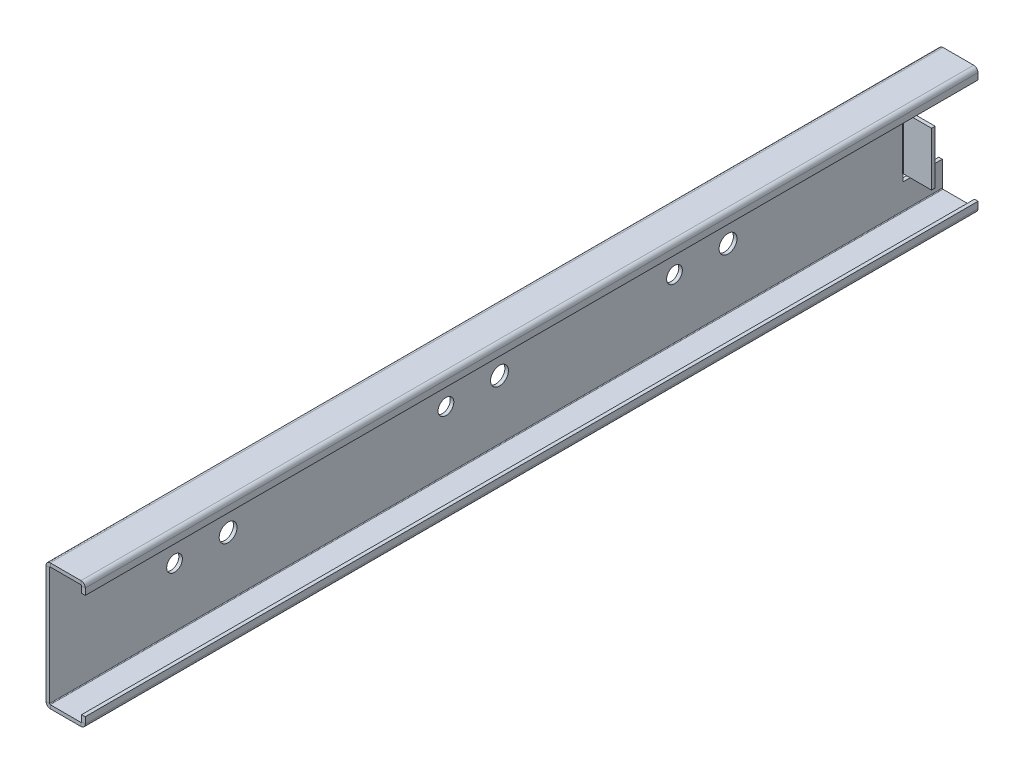
from build123d import *

# Parameters (mm, degrees)
SM_BASE_FLANGE_1_DEPTH           = 125
SKETCH_3_W                       = 11
SKETCH_3_H                       = 19
CUT_EXTRUDE_1_DEPTH              = 1
SM_EDGE_FLANGE_1_STRIP_W         = 4.4
SM_EDGE_FLANGE_1_STRIP_H         = 1
SM_EDGE_FLANGE_1_STRIP_CUT_DEPTH = 15
SM_EDGE_FLANGE_1_DEPTH           = 15
SKETCH_7_R                       = 2.5
SKETCH_7_R_2                     = 2.2
CUT_EXTRUDE_2_DEPTH              = 1
SKETCH_8_R                       = 2.2
SKETCH_8_R_2                     = 2.5
CUT_EXTRUDE_3_DEPTH              = 1


# Sheet-metal steps are written as plain solids
with BuildPart() as part:
    # Sketch 1 → Базовая кромка1 (new, symmetric)
    with BuildSketch(Plane.XY):
        with BuildLine():
            Line((11, 14.7), (11, 16.5))
            ThreePointArc((11, 16.5), (10.648528137, 17.348528137), (9.8, 17.7))
            Line((9.8, 17.7), (1.2, 17.7))
            ThreePointArc((1.2, 17.7), (0.351471863, 17.348528137), (0, 16.5))
            Line((0, 16.5), (0, -16.5))
            ThreePointArc((0, -16.5), (0.351471863, -17.348528137), (1.2, -17.7))
            Line((1.2, -17.7), (9.8, -17.7))
            ThreePointArc((9.8, -17.7), (10.648528137, -17.348528137), (11, -16.5))
            Line((11, -16.5), (11, -14.7))
            Line((11, -14.7), (10, -14.7))
            Line((10, -14.7), (10, -16.5))
            ThreePointArc((10, -16.5), (9.941421356, -16.641421356), (9.8, -16.7))
            Line((9.8, -16.7), (1.2, -16.7))
            ThreePointArc((1.2, -16.7), (1.058578644, -16.641421356), (1, -16.5))
            Line((1, -16.5), (1, 16.5))
            ThreePointArc((1, 16.5), (1.058578644, 16.641421356), (1.2, 16.7))
            Line((1.2, 16.7), (9.8, 16.7))
            ThreePointArc((9.8, 16.7), (9.941421356, 16.641421356), (10, 16.5))
            Line((10, 16.5), (10, 14.7))
            Line((10, 14.7), (11, 14.7))
        make_face()
    extrude(amount=SM_BASE_FLANGE_1_DEPTH, both=True)

    # Эскиз3 → Вытянуть1 (cut)
    with BuildSketch(Plane(origin=(1, 0, 0), x_dir=(0, 0, -1), z_dir=(1, 0, 0))):
        with Locations((119.5, 0)):
            Rectangle(SKETCH_3_W, SKETCH_3_H)
    extrude(amount=-CUT_EXTRUDE_1_DEPTH, mode=Mode.SUBTRACT)

    # Ребро-кромка1 strip (across the edge) → Ребро-кромка1 strip cut (cut)
    with BuildSketch(Plane(origin=(1, -7.5, -114), x_dir=(0, 0, 1), z_dir=(0, 1, 0))):
        with Locations((-2, -0.5)):
            Rectangle(SM_EDGE_FLANGE_1_STRIP_W, SM_EDGE_FLANGE_1_STRIP_H)
    extrude(amount=SM_EDGE_FLANGE_1_STRIP_CUT_DEPTH, mode=Mode.SUBTRACT)

    # Ребро-кромка1 section (across the edge) → Ребро-кромка1 (add)
    with BuildSketch(Plane(origin=(1, -7.5, -114), x_dir=(0, 0, 1), z_dir=(0, 1, 0))):
        with BuildLine():
            Line((-1, 0.2), (-1, 8))
            Line((-1, 8), (0, 8))
            Line((0, 8), (0, 0.2))
            ThreePointArc((0, 0.2), (0.058578644, 0.058578644), (0.2, 0))
            Line((0.2, 0), (0.2, -1))
            ThreePointArc((0.2, -1), (-0.648528137, -0.648528137), (-1, 0.2))
        make_face()
    extrude(amount=SM_EDGE_FLANGE_1_DEPTH)

    # Эскиз7 → Вытянуть2 (cut)
    with BuildSketch(Plane(origin=(1, 0, 0), x_dir=(0, 0, -1), z_dir=(1, 0, 0))):
        with Locations(Location((65, 0, 0), (0, 0, 90))):
            Circle(SKETCH_7_R)
        with Locations(Location((50, 0, 0), (0, 0, 90))):
            Circle(SKETCH_7_R_2)
        with Locations(Location((1, 0, 0), (0, 0, 90))):
            Circle(SKETCH_7_R)
        with Locations(Location((-14, 0, 0), (0, 0, 90))):
            Circle(SKETCH_7_R_2)
    extrude(amount=-CUT_EXTRUDE_2_DEPTH, mode=Mode.SUBTRACT)

    # Эскиз8 → Вытянуть3 (cut)
    with BuildSketch(Plane(origin=(1, 0, 0), x_dir=(0, 0, -1), z_dir=(1, 0, 0))):
        with Locations(Location((-90, 0, 0), (0, 0, 90))):
            Circle(SKETCH_8_R)
        with Locations(Location((-75, 0, 0), (0, 0, 90))):
            Circle(SKETCH_8_R_2)
    extrude(amount=-CUT_EXTRUDE_3_DEPTH, mode=Mode.SUBTRACT)


solid = part.part
